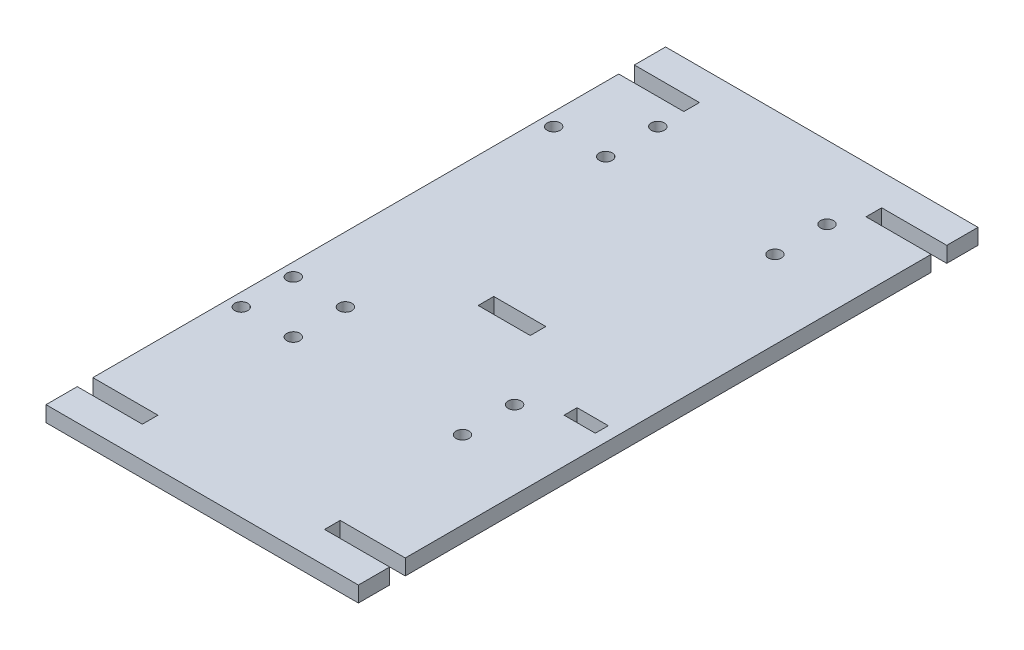
from build123d import *

# Parameters (mm, degrees)
SKETCH1_W            = 120
SKETCH1_H            = 238
BOSS_EXTRUDE1_DEPTH  = 6
SKETCH2_W            = 25
SKETCH2_H            = 6
CUT_EXTRUDE1_DEPTH   = 267.608326952
LPATTERN1_COUNT      = 2
LPATTERN1_PITCH      = 208
LPATTERN1_COUNT_DIR2 = 2
LPATTERN1_PITCH_DIR2 = 95
SKETCH3_W            = 20
SKETCH3_H            = 6
CUT_EXTRUDE2_DEPTH   = 10
SKETCH4_R            = 2.5
CUT_EXTRUDE4_DEPTH   = 10
SKETCH6_W            = 12
SKETCH6_H            = 5
CUT_EXTRUDE5_DEPTH   = 10


with BuildPart() as part:
    # Sketch1 → Boss-Extrude1 (new body)
    with BuildSketch(Plane(origin=(0, 0, 0), x_dir=(1, 0, 0), z_dir=(0, 1, 0))):
        with Locations((-60, 119)):
            Rectangle(SKETCH1_W, SKETCH1_H)
    extrude(amount=BOSS_EXTRUDE1_DEPTH)

    # Sketch2 → Cut-Extrude1 (cut, through all)
    with BuildSketch(Plane(origin=(0, 6, 0), x_dir=(1, 0, 0), z_dir=(0, 1, 0))):
        with Locations((-107.5, 223)):
            Rectangle(SKETCH2_W, SKETCH2_H)
    cut_extrude1 = extrude(amount=-CUT_EXTRUDE1_DEPTH, mode=Mode.SUBTRACT)

    # LPattern1: Cut-Extrude1 2 × 2
    with Locations(*[(j * LPATTERN1_PITCH_DIR2, 0, i * LPATTERN1_PITCH) for i in range(LPATTERN1_COUNT) for j in range(LPATTERN1_COUNT_DIR2) if (i, j) != (0, 0)]):
        add(cut_extrude1, mode=Mode.SUBTRACT)

    # Sketch3 → Cut-Extrude2 (cut)
    with BuildSketch(Plane(origin=(0, 6, 0), x_dir=(1, 0, 0), z_dir=(0, 1, 0))):
        with Locations((-60, 119)):
            Rectangle(SKETCH3_W, SKETCH3_H)
    extrude(amount=-CUT_EXTRUDE2_DEPTH, mode=Mode.SUBTRACT)

    # Sketch4 → Cut-Extrude4 (cut)
    with BuildSketch(Plane(origin=(0, 6, 0), x_dir=(1, 0, 0), z_dir=(0, 1, 0))):
        with Locations((-30, 210)):
            Circle(SKETCH4_R)
        with Locations((-30, 190)):
            Circle(SKETCH4_R)
        with Locations((-95, 210)):
            Circle(SKETCH4_R)
        with Locations((-95, 190)):
            Circle(SKETCH4_R)
        with Locations((-115, 190)):
            Circle(SKETCH4_R)
        with Locations((-95, 90)):
            Circle(SKETCH4_R)
        with Locations((-115, 90)):
            Circle(SKETCH4_R)
        with Locations((-95, 70)):
            Circle(SKETCH4_R)
        with Locations((-30, 90)):
            Circle(SKETCH4_R)
        with Locations((-30, 70)):
            Circle(SKETCH4_R)
        with Locations((-115, 70)):
            Circle(SKETCH4_R)
    extrude(amount=-CUT_EXTRUDE4_DEPTH, mode=Mode.SUBTRACT)

    # Sketch6 → Cut-Extrude5 (cut)
    with BuildSketch(Plane(origin=(0, 6, 0), x_dir=(1, 0, 0), z_dir=(0, 1, 0))):
        with Locations((-11, 98.5)):
            Rectangle(SKETCH6_W, SKETCH6_H)
    extrude(amount=-CUT_EXTRUDE5_DEPTH, mode=Mode.SUBTRACT)


solid = part.part
